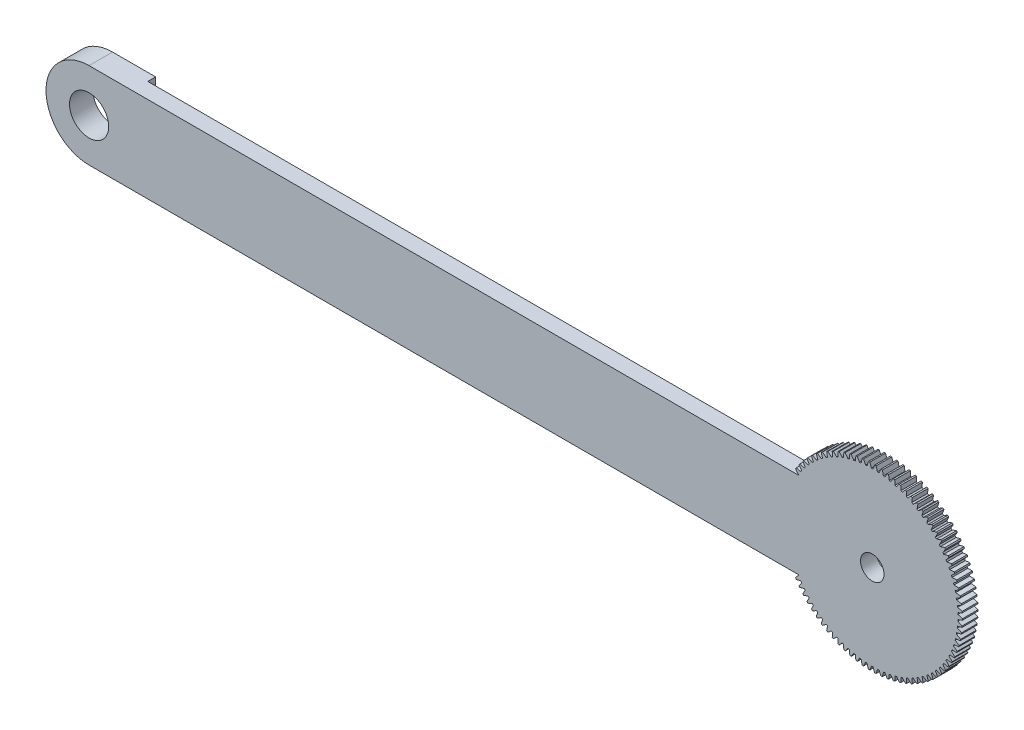
from build123d import *

# Parameters (mm, degrees)
BASPROSKE_W           = 4
BASPROSKE_H           = 23
TOOTHCUT_DEPTH        = 33.771939216
TEETHCUTS_COUNT       = 90
TEETHCUTS_ANGLE       = 356
BORSKE_R              = 5
BORE_DEPTH            = 50.0000508
BOSS_EXTRUDE1_DEPTH   = 4
SKETCH3_R             = 5
CUT_EXTRUDE2_DEPTH    = 213.286586066
SKETCH4_R             = 3
CUT_EXTRUDE4_DEPTH    = 213.286586066
BODY_MOVE_COPY1_ANGLE = 90
BODY_MOVE_COPY2_ANGLE = 180
SKETCH5_R             = 5
BOSS_EXTRUDE2_DEPTH   = 2


with BuildPart() as part:
    # BasProSke → Base-Revolve (revolve)
    with BuildSketch(Plane(origin=(0, 0, 0), x_dir=(1, 0, 0), z_dir=(0, 1, 0))):
        with Locations((2, 11.5)):
            Rectangle(BASPROSKE_W, BASPROSKE_H)
    revolve(axis=Axis((-10, 0, 0), (1, 0, 0)))

    # TooCutSke → ToothCut (cut, through all)
    with BuildSketch(Plane(origin=(0, 0, 0), x_dir=(0, 0, -1), z_dir=(1, 0, 0))):
        with BuildLine():
            ThreePointArc((0.208497677, 21.873006303), (0, 21.874), (-0.208497677, 21.873006303))
            ThreePointArc((-0.208497677, 21.873006303), (-0.408932112, 22.452130021), (-0.648312723, 23.016271109))
            ThreePointArc((-0.648312723, 23.016271109), (0, 23.0254), (0.648312723, 23.016271109))
            ThreePointArc((0.648312723, 23.016271109), (0.408932112, 22.452130021), (0.208497677, 21.873006303))
        make_face()
    toothcut = extrude(amount=TOOTHCUT_DEPTH, mode=Mode.SUBTRACT)

    # TeethCuts: ToothCut ×90 about axis
    teethcuts_axis = Axis((-10, 0, 0), (1, 0, 0))
    for i in range(1, TEETHCUTS_COUNT):
        add(toothcut.rotate(teethcuts_axis, i * TEETHCUTS_ANGLE / (TEETHCUTS_COUNT - 1)), mode=Mode.SUBTRACT)

    # BorSke → Bore (cut, symmetric)
    with BuildSketch(Plane(origin=(0, 0, 0), x_dir=(0, 0, -1), z_dir=(1, 0, 0))):
        Circle(BORSKE_R)
    extrude(amount=BORE_DEPTH, both=True, mode=Mode.SUBTRACT)

    # Sketch1 → Boss-Extrude1 (add)
    with BuildSketch(Plane(origin=(0, 0, 0), x_dir=(0, 0, -1), z_dir=(1, 0, 0))):
        with BuildLine():
            Line((0, -11), (-200, -11))
            ThreePointArc((-200, -11), (-211, 0), (-200, 11))
            Line((-200, 11), (0, 11))
            ThreePointArc((0, 11), (11, 0), (0, -11))
        make_face()
    extrude(amount=BOSS_EXTRUDE1_DEPTH)

    # Sketch3 → Cut-Extrude2 (cut, through all)
    with BuildSketch(Plane(origin=(0, 0, 0), x_dir=(0, 0, -1), z_dir=(1, 0, 0))):
        with Locations((-200, 0)):
            Circle(SKETCH3_R)
    extrude(amount=CUT_EXTRUDE2_DEPTH, mode=Mode.SUBTRACT)

    # Sketch4 → Cut-Extrude4 (cut, through all)
    with BuildSketch(Plane(origin=(0, 0, 0), x_dir=(0, 0, -1), z_dir=(1, 0, 0))):
        Circle(SKETCH4_R)
    extrude(amount=CUT_EXTRUDE4_DEPTH, mode=Mode.SUBTRACT)


with BuildPart() as part_1:
    # Body-Move/Copy1: moved
    add(part.part.rotate(Axis((2, 0, 94), (0, 1, 0)), BODY_MOVE_COPY1_ANGLE))


with BuildPart() as part_2:
    # Body-Move/Copy2: moved
    add(part_1.part.rotate(Axis((2, 0, 0), (0, 0, 1)), BODY_MOVE_COPY2_ANGLE))

    # Sketch5 → Boss-Extrude2 (add)
    with BuildSketch(Plane(origin=(0, 0, 92), x_dir=(-1, 0, 0), z_dir=(0, 0, -1))):
        with BuildLine():
            Line((93, 11), (93, -11))
            Line((93, -11), (104, -11))
            ThreePointArc((104, -11), (115, 0), (104, 11))
            Line((104, 11), (93, 11))
        make_face()
        with Locations((104, 0)):
            Circle(SKETCH5_R, mode=Mode.SUBTRACT)
    extrude(amount=BOSS_EXTRUDE2_DEPTH)


solid = part_2.part
